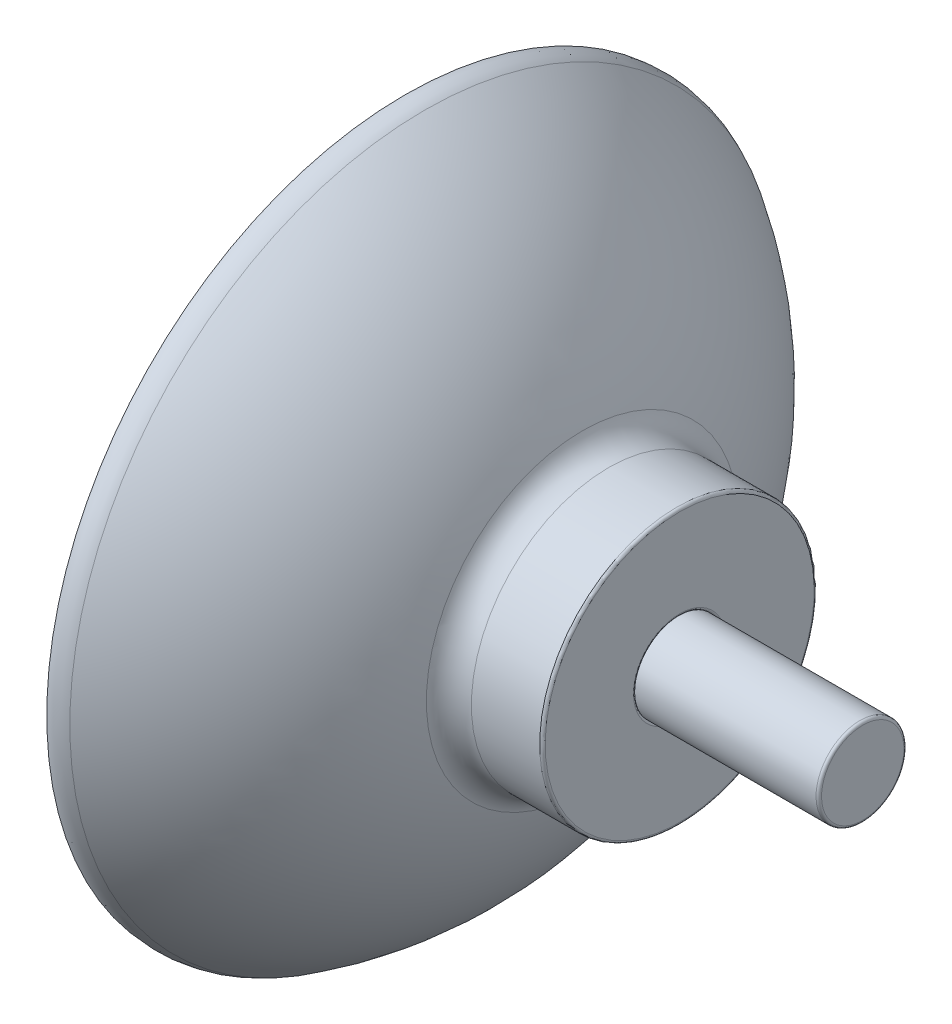
from build123d import *

# Parameters (mm, degrees)
FILLET1_R = 0.15
FILLET2_R = 1.5
FILLET3_R = 0.15


with BuildPart() as part:
    # Sketch1 → Revolve1 (revolve)
    with BuildSketch(Plane.XY):
        with BuildLine():
            Line((0, 4), (0, 0))
            Line((0, 0), (2, 0))
            Line((2, 0), (2, 4.75))
            Line((2, 4.75), (4, 4.75))
            Line((4, 4.75), (4, 2.375))
            Line((4, 2.375), (5, 2.375))
            Line((5, 2.375), (5, 7.5))
            Line((5, 7.5), (0, 7.5))
            ThreePointArc((0, 7.5), (-3.694854211, 14.794116631), (-10, 20))
            Line((-10, 20), (-10, 19.5))
            ThreePointArc((-10, 19.5), (-3.297071482, 12.84866356), (0, 4))
        make_face()
    revolve(axis=Axis((0, 0, 0), (-1, 0, 0)))

    # Fillet1
    fillet1_edges = [part.edges().sort_by_distance(p)[0] for p in [
        (0, -4, 0),
        (-10, -19.5, 0),
        (5, -7.5, 0),
        (5, -2.375, 0),
        (4, -2.375, 0),
    ]]
    fillet(fillet1_edges, radius=FILLET1_R)

    # Fillet2
    # the kernel refuses this fillet: 1.5 mm, written as the material it adds along each edge
    with BuildSketch(Plane(origin=(0, 0, 0), x_dir=(0, 1, 0), z_dir=(0, 0, 1))) as fillet2_piece_1:
        with BuildLine():
            CenterArc((9, -1.117230926), FILLET2_R, 108.15675825, 71.84324175)
            Line((7.5, -1.117230926), (7.5, 0))
            ThreePointArc((7.5, 0), (8.018361801, 0.147084824), (8.532573187, 0.308080329))
        make_face()
    revolve(axis=Axis((0, 0, 0), (-1, 0, 0)))
    # the kernel refuses this fillet: 1.5 mm, written as the material it takes off along each edge
    with BuildSketch(Plane(origin=(-10, 0, 0), x_dir=(0, 1, 0), z_dir=(0, 0, 1))) as fillet2_2_piece_1:
        with BuildLine():
            CenterArc((18.111217478, -0.293092194), FILLET2_R, 328.720951381, 42.546835999)
            ThreePointArc((19.393190597, -1.071902134), (19.704849183, -0.540623634), (20, 0))
            Line((20, 0), (19.58230448, 0))
        make_face()
    revolve(axis=Axis((-10, 0, 0), (-1, 0, 0)), mode=Mode.SUBTRACT)

    # Sketch2 → Revolve2 (revolve)
    with BuildSketch(Plane.XY):
        Polygon((2, 0), (2, 4.75), (4, 4.75), (4, 2.4), (15, 2.4), (15, 0), align=None)
    revolve(axis=Axis((15, 0, 0), (-1, 0, 0)))

    # Fillet3
    fillet3_edges = [part.edges().sort_by_distance(p)[0] for p in [
        (15, -2.4, 0),
    ]]
    fillet(fillet3_edges, radius=FILLET3_R)


solid = part.part
